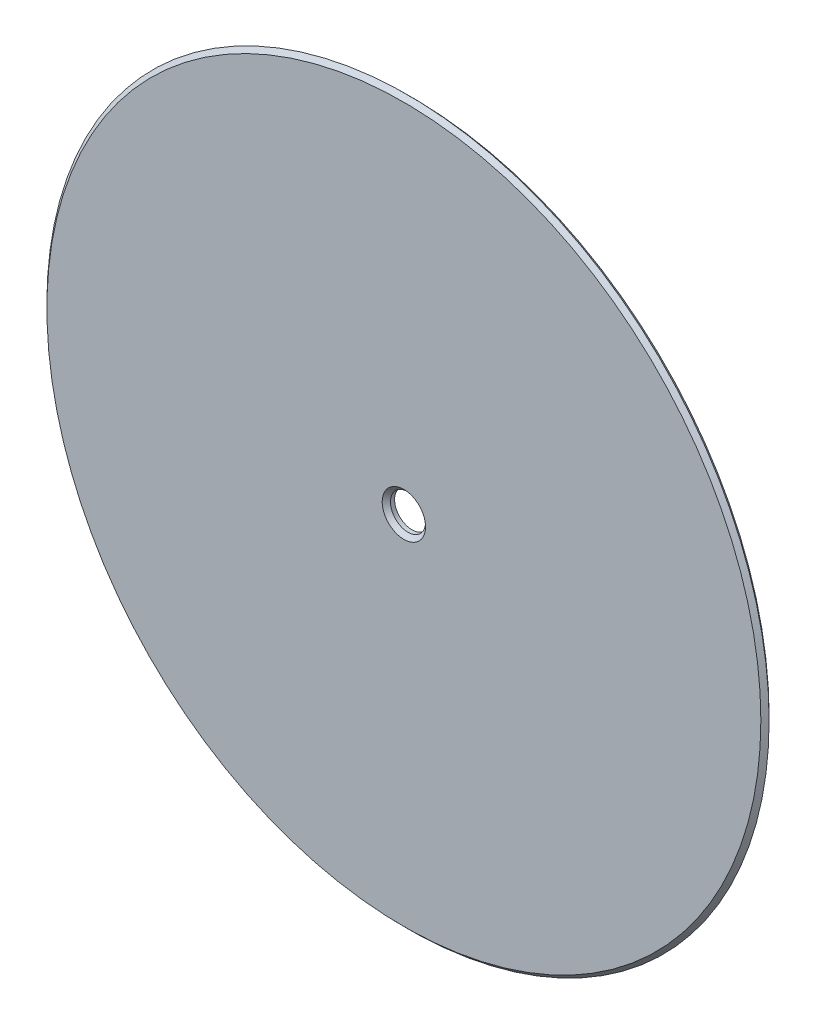
from build123d import *

# Parameters (mm, degrees)
SKETCH1_R           = 44.45
SKETCH1_R_2         = 2.159
BOSS_EXTRUDE1_DEPTH = 1.016
CHAMFER2_SIZE       = 0.508


with BuildPart() as part:
    # Sketch1 → Boss-Extrude1 (new body)
    with BuildSketch(Plane.XY):
        Circle(SKETCH1_R)
        Circle(SKETCH1_R_2, mode=Mode.SUBTRACT)
    extrude(amount=BOSS_EXTRUDE1_DEPTH)

    # Chamfer2
    chamfer2_edges = [part.edges().sort_by_distance(p)[0] for p in [
        (-44.45, 0, 0),
        (-44.45, 0, 1.016),
        (-2.159, 0, 1.016),
    ]]
    chamfer(chamfer2_edges, length=CHAMFER2_SIZE - 0.0001)  # a hair under: the kernel refuses the full size


solid = part.part
